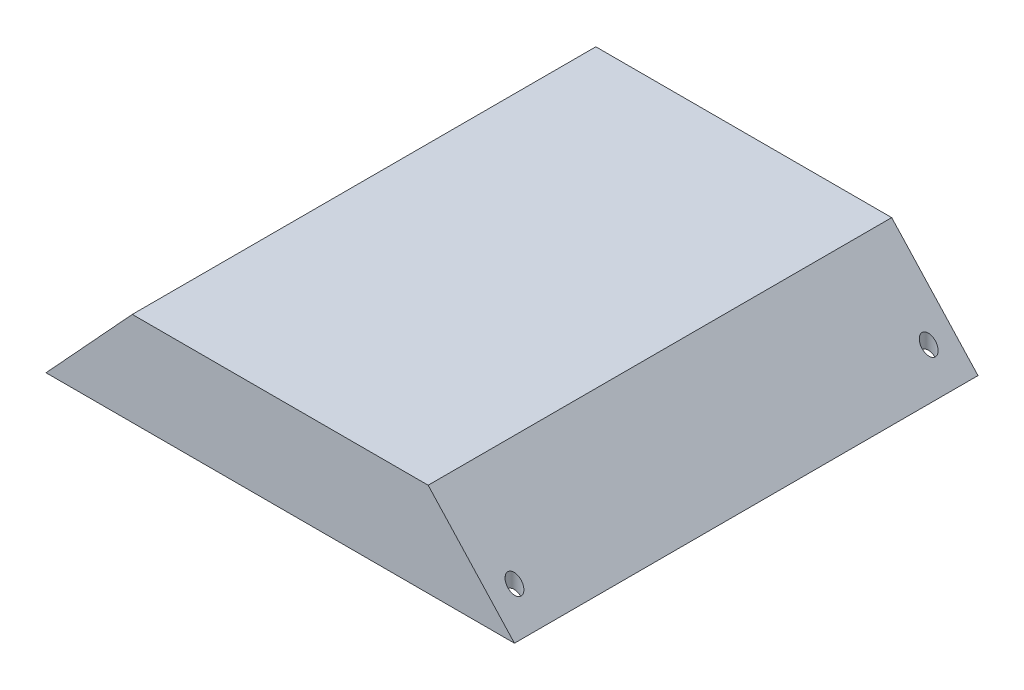
from build123d import *

# Parameters (mm, degrees)
SALIENTE_EXTRUIR1_DEPTH        = 94
CORTAR_EXTRUIR1_DEPTH          = 91
TALADRO_DE_MARGEN_PARA_M2_51_D = 2.7


with BuildPart() as part:
    # Croquis2 → Saliente-Extruir1 (new body)
    with BuildSketch(Plane.XY):
        Polygon((-30, 19), (-47.5, 0), (47.5, 0), (30, 19), align=None)
    extrude(amount=SALIENTE_EXTRUIR1_DEPTH)

    # Croquis3 → Cortar-Extruir1 (cut)
    with BuildSketch(Plane(origin=(0, 0, 0), x_dir=(-1, 0, 0), z_dir=(0, 0, -1))):
        Polygon((-30, 16), (-44.736842105, 0), (44.736842105, 0), (30, 16), align=None)
    extrude(amount=-CORTAR_EXTRUIR1_DEPTH, mode=Mode.SUBTRACT)

    # Taladro de margen para M2.51 (through all)
    with Locations(Plane(origin=(0, 19, 0), x_dir=(1, 0, 0), z_dir=(0, 1, 0))):
        with Locations((-42.5, -5), (42.5, -5), (-42.5, -89), (42.5, -89)):
            Hole(TALADRO_DE_MARGEN_PARA_M2_51_D / 2)


solid = part.part
